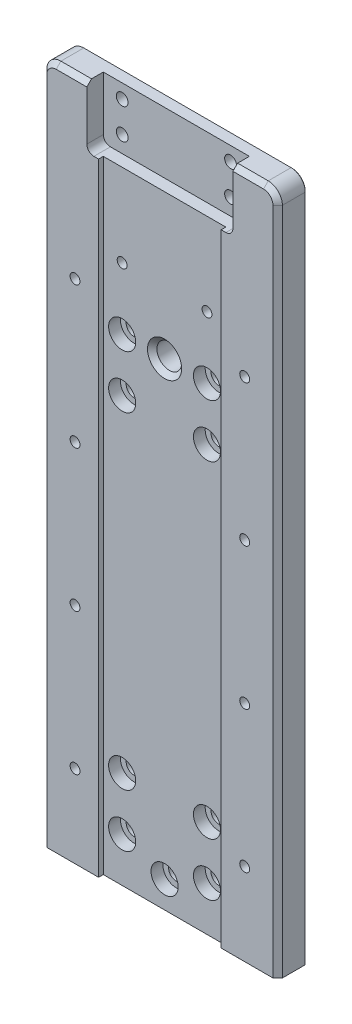
from build123d import *

# Parameters (mm, degrees)
SKETCH1_W               = 100
SKETCH1_H               = 290
BOSS_EXTRUDE1_DEPTH     = 6
SKETCH2_W               = 62
SKETCH2_H               = 26
CUT_EXTRUDE1_DEPTH      = 7
SKETCH3_W               = 52
SKETCH3_H               = 290
CUT_EXTRUDE2_DEPTH      = 2
SKETCH4_R               = 2.5
SKETCH4_R_2             = 5.25
SKETCH4_R_3             = 2.1
SKETCH4_R_4             = 3.3
CUT_EXTRUDE_HOLES_DEPTH = 21
FILLET1_R               = 3
FILLET2_R               = 6
CHAMFER1_SIZE           = 2
SKETCH5_R               = 5.75
CUT_EXTRUDE5_DEPTH      = 5
CHAMFER2_SIZE           = 2
CHAMFER3_SIZE           = 0.3


with BuildPart() as part:
    # Sketch1 → Boss-Extrude1 (new, symmetric)
    with BuildSketch(Plane.XY):
        Rectangle(SKETCH1_W, SKETCH1_H)
    extrude(amount=BOSS_EXTRUDE1_DEPTH, both=True)

    # Sketch2 → Cut-Extrude1 (cut)
    with BuildSketch(Plane.XY.offset(6)):
        with Locations((0, 132)):
            Rectangle(SKETCH2_W, SKETCH2_H)
    extrude(amount=-CUT_EXTRUDE1_DEPTH, mode=Mode.SUBTRACT)

    # Sketch3 → Cut-Extrude2 (cut)
    with BuildSketch(Plane.XY.offset(6)):
        Rectangle(SKETCH3_W, SKETCH3_H)
    extrude(amount=-CUT_EXTRUDE2_DEPTH, mode=Mode.SUBTRACT)

    # Sketch4 → Cut-Extrude HOLES (cut)
    with BuildSketch(Plane.XY.offset(-6)):
        with Locations((-23, 139)):
            Circle(SKETCH4_R)
        with Locations((23, 139)):
            Circle(SKETCH4_R)
        with Locations((23, 126)):
            Circle(SKETCH4_R)
        with Locations((-23, 126)):
            Circle(SKETCH4_R)
        with Locations((0, 57.59)):
            Circle(SKETCH4_R_2)
        with Locations((-18, 83.89)):
            Circle(SKETCH4_R_3)
        with Locations((-18, 57.59)):
            Circle(SKETCH4_R_4)
        with Locations((-18, 35.09)):
            Circle(SKETCH4_R_4)
        with Locations((-36, 70)):
            Circle(SKETCH4_R_3)
        with Locations((-36, 10)):
            Circle(SKETCH4_R_3)
        with Locations((-36, -110)):
            Circle(SKETCH4_R_3)
        with Locations((-36, -50)):
            Circle(SKETCH4_R_3)
        with Locations((-18, -103.65)):
            Circle(SKETCH4_R_4)
        with Locations((-18, -126.15)):
            Circle(SKETCH4_R_4)
        with Locations((18, -103.65)):
            Circle(SKETCH4_R_4)
        with Locations((18, -126.15)):
            Circle(SKETCH4_R_4)
        with Locations((0, -133.65)):
            Circle(SKETCH4_R_4)
        with Locations((36, 70)):
            Circle(SKETCH4_R_3)
        with Locations((18, 83.89)):
            Circle(SKETCH4_R_3)
        with Locations((18, 35.09)):
            Circle(SKETCH4_R_4)
        with Locations((18, 57.59)):
            Circle(SKETCH4_R_4)
        with Locations((36, 10)):
            Circle(SKETCH4_R_3)
        with Locations((36, -50)):
            Circle(SKETCH4_R_3)
        with Locations((36, -110)):
            Circle(SKETCH4_R_3)
    extrude(amount=CUT_EXTRUDE_HOLES_DEPTH, mode=Mode.SUBTRACT)

    # Fillet1
    fillet1_edges = [part.edges().sort_by_distance(p)[0] for p in [
        (31, 119, 2.5),
        (-31, 119, 2.5),
    ]]
    fillet(fillet1_edges, radius=FILLET1_R)

    # Fillet2
    fillet2_edges = [part.edges().sort_by_distance(p)[0] for p in [
        (50, 145, 0),
        (-50, 145, 0),
    ]]
    fillet(fillet2_edges, radius=FILLET2_R)

    # Chamfer1
    chamfer1_edges = [part.edges().sort_by_distance(p)[0] for p in [
        (50, -3, 6),
        (48.242640687, 143.242640687, 6),
        (37.5, 145, 6),
        (-50, -3, 6),
        (-48.242640687, 143.242640687, 6),
        (-37.5, 145, 6),
    ]]
    chamfer(chamfer1_edges, length=CHAMFER1_SIZE)

    # Sketch5 → Cut-Extrude5 (cut)
    with BuildSketch(Plane.XY.offset(4)):
        with Locations((-18, 57.59)):
            Circle(SKETCH5_R)
        with Locations((-18, 35.09)):
            Circle(SKETCH5_R)
        with Locations((18, 35.09)):
            Circle(SKETCH5_R)
        with Locations((18, 57.59)):
            Circle(SKETCH5_R)
        with Locations((18, -103.65)):
            Circle(SKETCH5_R)
        with Locations((-18, -103.65)):
            Circle(SKETCH5_R)
        with Locations((-18, -126.15)):
            Circle(SKETCH5_R)
        with Locations((0, -133.65)):
            Circle(SKETCH5_R)
        with Locations((18, -126.15)):
            Circle(SKETCH5_R)
    extrude(amount=-CUT_EXTRUDE5_DEPTH, mode=Mode.SUBTRACT)

    # Chamfer2
    chamfer2_edges = [part.edges().sort_by_distance(p)[0] for p in [
        (-5.25, 57.59, 4),
    ]]
    chamfer(chamfer2_edges, length=CHAMFER2_SIZE)

    # Chamfer3
    chamfer3_edges = [part.edges().sort_by_distance(p)[0] for p in [
        (-50, -3, -6),
        (-48.242640687, 143.242640687, -6),
        (48.242640687, 143.242640687, -6),
        (50, -3, -6),
        (0, 145, -6),
    ]]
    chamfer(chamfer3_edges, length=CHAMFER3_SIZE)


solid = part.part
